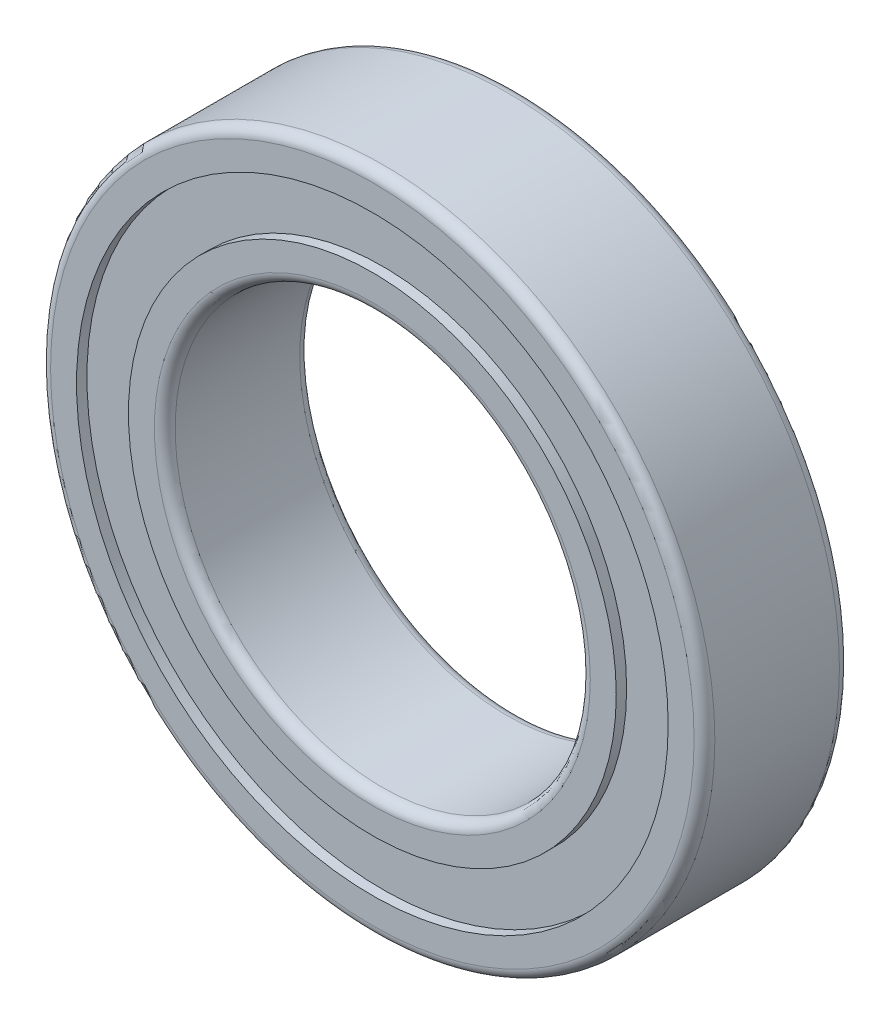
from build123d import *

# Parameters (mm, degrees)
SKETCH1_R           = 16
SKETCH1_R_2         = 10
BOSS_EXTRUDE1_DEPTH = 7
FILLET1_R           = 0.5
SKETCH2_R           = 14.25
SKETCH2_R_2         = 11.75
CUT_EXTRUDE1_DEPTH  = 0.5
CUT_EXTRUDE2_START  = -0.5
SKETCH3_R           = 14.25
SKETCH3_R_2         = 11.75
CUT_EXTRUDE2_DEPTH  = 0.5


with BuildPart() as part:
    # Sketch1 → Boss-Extrude1 (new body)
    with BuildSketch(Plane.XY):
        with Locations((80, 28.257283518)):
            Circle(SKETCH1_R)
        with Locations((80, 28.257283518)):
            Circle(SKETCH1_R_2, mode=Mode.SUBTRACT)
    extrude(amount=BOSS_EXTRUDE1_DEPTH)

    # Fillet1
    fillet1_edges = [part.edges().sort_by_distance(p)[0] for p in [
        (64, 28.257283518, 7),
        (64, 28.257283518, 0),
        (70, 28.257283518, 0),
        (70, 28.257283518, 7),
    ]]
    fillet(fillet1_edges, radius=FILLET1_R)

    # Sketch2 → Cut-Extrude1 (cut)
    with BuildSketch(Plane(origin=(0, 0, 0), x_dir=(-1, 0, 0), z_dir=(0, 0, -1))):
        with Locations((-80, 28.257283518)):
            Circle(SKETCH2_R)
        with Locations((-80, 28.257283518)):
            Circle(SKETCH2_R_2, mode=Mode.SUBTRACT)
    extrude(amount=-CUT_EXTRUDE1_DEPTH, mode=Mode.SUBTRACT)

    # Sketch3 → Cut-Extrude2 (cut)
    with BuildSketch(Plane.XY.offset(7).offset(CUT_EXTRUDE2_START)):
        with Locations((80, 28.257283518)):
            Circle(SKETCH3_R)
        with Locations((80, 28.257283518)):
            Circle(SKETCH3_R_2, mode=Mode.SUBTRACT)
    extrude(amount=CUT_EXTRUDE2_DEPTH, mode=Mode.SUBTRACT)


solid = part.part
